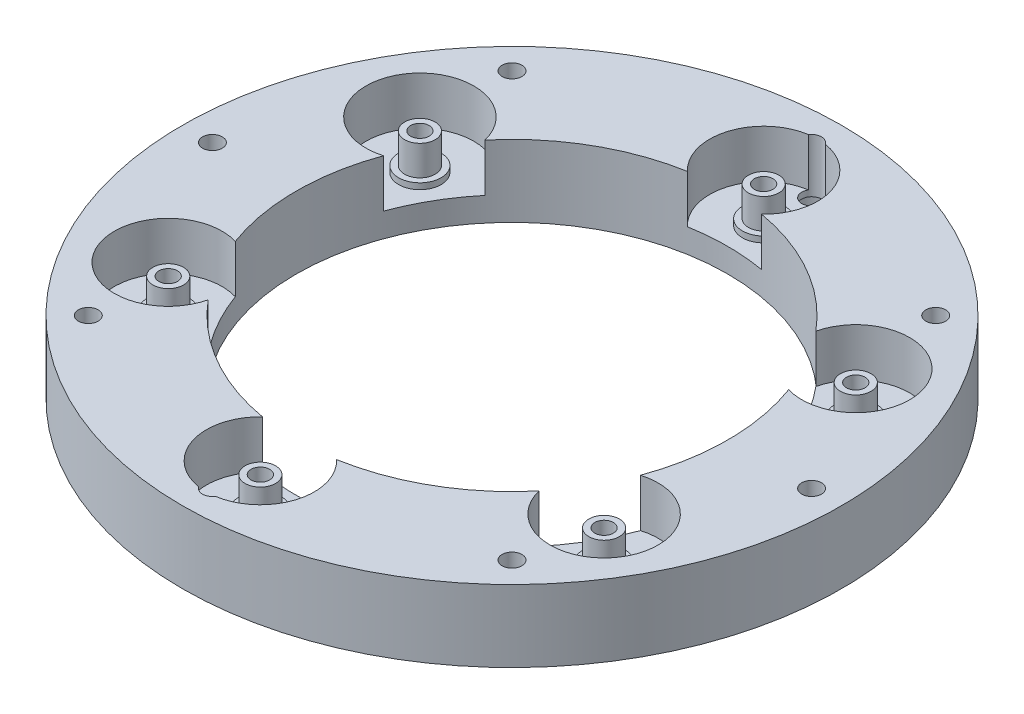
from build123d import *

# Parameters (mm, degrees)
SKETCH1_R           = 55
SKETCH1_R_2         = 36
SKETCH1_R_3         = 1.55
BOSS_EXTRUDE1_DEPTH = 4
SKETCH3_R           = 3.55
SKETCH3_R_2         = 1.55
BOSS_EXTRUDE2_DEPTH = 1
SKETCH5_R           = 2.55
SKETCH5_R_2         = 1.55
BOSS_EXTRUDE3_DEPTH = 5
SKETCH6_R           = 55
BOSS_EXTRUDE4_DEPTH = 8
SKETCH8_R           = 1.65
CUT_EXTRUDE2_DEPTH  = 79.70196948
SKETCH7_R           = 3.55
SKETCH7_R_2         = 1.55
SKETCH7_R_3         = 3.65
SKETCH7_R_4         = 1.65
CUT_EXTRUDE1_DEPTH  = 3


with BuildPart() as part:
    # Sketch1 → Boss-Extrude1 (new body)
    with BuildSketch(Plane(origin=(0, 0, 0), x_dir=(1, 0, 0), z_dir=(0, 1, 0))):
        Circle(SKETCH1_R)
        Circle(SKETCH1_R_2, mode=Mode.SUBTRACT)
        with Locations((0, 42)):
            Circle(SKETCH1_R_3, mode=Mode.SUBTRACT)
        with Locations((36.373066959, 21)):
            Circle(SKETCH1_R_3, mode=Mode.SUBTRACT)
        with Locations((36.373066959, -21)):
            Circle(SKETCH1_R_3, mode=Mode.SUBTRACT)
        with Locations((0, -42)):
            Circle(SKETCH1_R_3, mode=Mode.SUBTRACT)
        with Locations((-36.373066959, -21)):
            Circle(SKETCH1_R_3, mode=Mode.SUBTRACT)
        with Locations((-36.373066959, 21)):
            Circle(SKETCH1_R_3, mode=Mode.SUBTRACT)
    extrude(amount=BOSS_EXTRUDE1_DEPTH)

    # Sketch3 → Boss-Extrude2 (add)
    # profile 1 of 6: a face of its own
    with BuildSketch(Plane(origin=(0, 4, 0), x_dir=(1, 0, 0), z_dir=(0, 1, 0))):
        with Locations((-36.373066959, 21)):
            Circle(SKETCH3_R)
        with Locations((-36.373066959, 21)):
            Circle(SKETCH3_R_2, mode=Mode.SUBTRACT)
    # profile 2 of 6: a face of its own
    with BuildSketch(Plane(origin=(0, 4, 0), x_dir=(1, 0, 0), z_dir=(0, 1, 0))):
        with Locations((0, -42)):
            Circle(SKETCH3_R)
        with Locations((0, -42)):
            Circle(SKETCH3_R_2, mode=Mode.SUBTRACT)
    # profile 3 of 6: a face of its own
    with BuildSketch(Plane(origin=(0, 4, 0), x_dir=(1, 0, 0), z_dir=(0, 1, 0))):
        with Locations((36.373066959, 21)):
            Circle(SKETCH3_R)
        with Locations((36.373066959, 21)):
            Circle(SKETCH3_R_2, mode=Mode.SUBTRACT)
    # profile 4 of 6: a face of its own
    with BuildSketch(Plane(origin=(0, 4, 0), x_dir=(1, 0, 0), z_dir=(0, 1, 0))):
        with Locations((0, 42)):
            Circle(SKETCH3_R)
        with Locations((0, 42)):
            Circle(SKETCH3_R_2, mode=Mode.SUBTRACT)
    # profile 5 of 6: a face of its own
    with BuildSketch(Plane(origin=(0, 4, 0), x_dir=(1, 0, 0), z_dir=(0, 1, 0))):
        with Locations((36.373066959, -21)):
            Circle(SKETCH3_R)
        with Locations((36.373066959, -21)):
            Circle(SKETCH3_R_2, mode=Mode.SUBTRACT)
    # profile 6 of 6: a face of its own
    with BuildSketch(Plane(origin=(0, 4, 0), x_dir=(1, 0, 0), z_dir=(0, 1, 0))):
        with Locations((-36.373066959, -21)):
            Circle(SKETCH3_R)
        with Locations((-36.373066959, -21)):
            Circle(SKETCH3_R_2, mode=Mode.SUBTRACT)
    extrude(amount=BOSS_EXTRUDE2_DEPTH)

    # Sketch5 → Boss-Extrude3 (add)
    # profile 1 of 6: a face of its own
    with BuildSketch(Plane(origin=(0, 5, 0), x_dir=(1, 0, 0), z_dir=(0, 1, 0))):
        with Locations((-36.373066959, -21)):
            Circle(SKETCH5_R)
        with Locations((-36.373066959, -21)):
            Circle(SKETCH5_R_2, mode=Mode.SUBTRACT)
    # profile 2 of 6: a face of its own
    with BuildSketch(Plane(origin=(0, 5, 0), x_dir=(1, 0, 0), z_dir=(0, 1, 0))):
        with Locations((0, -42)):
            Circle(SKETCH5_R)
        with Locations((0, -42)):
            Circle(SKETCH5_R_2, mode=Mode.SUBTRACT)
    # profile 3 of 6: a face of its own
    with BuildSketch(Plane(origin=(0, 5, 0), x_dir=(1, 0, 0), z_dir=(0, 1, 0))):
        with Locations((36.373066959, -21)):
            Circle(SKETCH5_R)
        with Locations((36.373066959, -21)):
            Circle(SKETCH5_R_2, mode=Mode.SUBTRACT)
    # profile 4 of 6: a face of its own
    with BuildSketch(Plane(origin=(0, 5, 0), x_dir=(1, 0, 0), z_dir=(0, 1, 0))):
        with Locations((36.373066959, 21)):
            Circle(SKETCH5_R)
        with Locations((36.373066959, 21)):
            Circle(SKETCH5_R_2, mode=Mode.SUBTRACT)
    # profile 5 of 6: a face of its own
    with BuildSketch(Plane(origin=(0, 5, 0), x_dir=(1, 0, 0), z_dir=(0, 1, 0))):
        with Locations((0, 42)):
            Circle(SKETCH5_R)
        with Locations((0, 42)):
            Circle(SKETCH5_R_2, mode=Mode.SUBTRACT)
    # profile 6 of 6: a face of its own
    with BuildSketch(Plane(origin=(0, 5, 0), x_dir=(1, 0, 0), z_dir=(0, 1, 0))):
        with Locations((-36.373066959, 21)):
            Circle(SKETCH5_R)
        with Locations((-36.373066959, 21)):
            Circle(SKETCH5_R_2, mode=Mode.SUBTRACT)
    extrude(amount=BOSS_EXTRUDE3_DEPTH)

    # Sketch6 → Boss-Extrude4 (add)
    with BuildSketch(Plane(origin=(0, 4, 0), x_dir=(1, 0, 0), z_dir=(0, 1, 0))):
        Circle(SKETCH6_R)
        with BuildLine():
            ThreePointArc((6.187442022, 35.464285714), (0, 51), (-6.187442022, 35.464285714))
            ThreePointArc((-6.187442022, 35.464285714), (-18, 31.176914536), (-27.619251345, 23.090624833))
            ThreePointArc((-27.619251345, 23.090624833), (-44.167295593, 25.5), (-33.806693367, 12.373660882))
            ThreePointArc((-33.806693367, 12.373660882), (-36, 0), (-33.806693367, -12.373660882))
            ThreePointArc((-33.806693367, -12.373660882), (-44.167295593, -25.5), (-27.619251345, -23.090624833))
            ThreePointArc((-27.619251345, -23.090624833), (-18, -31.176914536), (-6.187442022, -35.464285714))
            ThreePointArc((-6.187442022, -35.464285714), (0, -51), (6.187442022, -35.464285714))
            ThreePointArc((6.187442022, -35.464285714), (18, -31.176914536), (27.619251345, -23.090624833))
            ThreePointArc((27.619251345, -23.090624833), (44.167295593, -25.5), (33.806693367, -12.373660882))
            ThreePointArc((33.806693367, -12.373660882), (36, 0), (33.806693367, 12.373660882))
            ThreePointArc((33.806693367, 12.373660882), (44.167295593, 25.5), (27.619251345, 23.090624833))
            ThreePointArc((27.619251345, 23.090624833), (18, 31.176914536), (6.187442022, 35.464285714))
        make_face(mode=Mode.SUBTRACT)
    extrude(amount=BOSS_EXTRUDE4_DEPTH)

    # Sketch8 → Cut-Extrude2 (cut, through all)
    with BuildSketch(Plane(origin=(0, 12, 0), x_dir=(1, 0, 0), z_dir=(0, 1, 0))):
        with Locations((0, 50)):
            Circle(SKETCH8_R)
        with Locations((35.355339059, 35.355339059)):
            Circle(SKETCH8_R)
        with Locations((50, 0)):
            Circle(SKETCH8_R)
        with Locations((35.355339059, -35.355339059)):
            Circle(SKETCH8_R)
        with Locations((0, -50)):
            Circle(SKETCH8_R)
        with Locations((-35.355339059, -35.355339059)):
            Circle(SKETCH8_R)
        with Locations((-50, 0)):
            Circle(SKETCH8_R)
        with Locations((-35.355339059, 35.355339059)):
            Circle(SKETCH8_R)
    extrude(amount=-CUT_EXTRUDE2_DEPTH, mode=Mode.SUBTRACT)

    # Sketch7 → Cut-Extrude1 (cut)
    # profile 1 of 14: a face of its own
    with BuildSketch(Plane.XZ):
        with Locations((-36.373066959, -21)):
            Circle(SKETCH7_R)
        with Locations((-36.373066959, -21)):
            Circle(SKETCH7_R_2, mode=Mode.SUBTRACT)
    # profile 2 of 14: a face of its own
    with BuildSketch(Plane.XZ):
        with Locations((-36.373066959, 21)):
            Circle(SKETCH7_R)
        with Locations((-36.373066959, 21)):
            Circle(SKETCH7_R_2, mode=Mode.SUBTRACT)
    # profile 3 of 14: a face of its own
    with BuildSketch(Plane.XZ):
        with Locations((0, 42)):
            Circle(SKETCH7_R)
        with Locations((0, 42)):
            Circle(SKETCH7_R_2, mode=Mode.SUBTRACT)
    # profile 4 of 14: a face of its own
    with BuildSketch(Plane.XZ):
        with Locations((36.373066959, 21)):
            Circle(SKETCH7_R)
        with Locations((36.373066959, 21)):
            Circle(SKETCH7_R_2, mode=Mode.SUBTRACT)
    # profile 5 of 14: a face of its own
    with BuildSketch(Plane.XZ):
        with Locations((36.373066959, -21)):
            Circle(SKETCH7_R)
        with Locations((36.373066959, -21)):
            Circle(SKETCH7_R_2, mode=Mode.SUBTRACT)
    # profile 6 of 14: a face of its own
    with BuildSketch(Plane.XZ):
        with Locations((0, -42)):
            Circle(SKETCH7_R)
        with Locations((0, -42)):
            Circle(SKETCH7_R_2, mode=Mode.SUBTRACT)
    # profile 7 of 14: a face of its own
    with BuildSketch(Plane.XZ):
        with Locations((-35.355339059, -35.355339059)):
            Circle(SKETCH7_R_3)
        with Locations((-35.355339059, -35.355339059)):
            Circle(SKETCH7_R_4, mode=Mode.SUBTRACT)
    # profile 8 of 14: a face of its own
    with BuildSketch(Plane.XZ):
        with Locations((-50, 0)):
            Circle(SKETCH7_R_3)
        with Locations((-50, 0)):
            Circle(SKETCH7_R_4, mode=Mode.SUBTRACT)
    # profile 9 of 14: a face of its own
    with BuildSketch(Plane.XZ):
        with Locations((-35.355339059, 35.355339059)):
            Circle(SKETCH7_R_3)
        with Locations((-35.355339059, 35.355339059)):
            Circle(SKETCH7_R_4, mode=Mode.SUBTRACT)
    # profile 10 of 14: a face of its own
    with BuildSketch(Plane.XZ):
        with Locations((0, 50)):
            Circle(SKETCH7_R_3)
        with Locations((0, 50)):
            Circle(SKETCH7_R_4, mode=Mode.SUBTRACT)
    # profile 11 of 14: a face of its own
    with BuildSketch(Plane.XZ):
        with Locations((35.355339059, 35.355339059)):
            Circle(SKETCH7_R_3)
        with Locations((35.355339059, 35.355339059)):
            Circle(SKETCH7_R_4, mode=Mode.SUBTRACT)
    # profile 12 of 14: a face of its own
    with BuildSketch(Plane.XZ):
        with Locations((50, 0)):
            Circle(SKETCH7_R_3)
        with Locations((50, 0)):
            Circle(SKETCH7_R_4, mode=Mode.SUBTRACT)
    # profile 13 of 14: a face of its own
    with BuildSketch(Plane.XZ):
        with Locations((35.355339059, -35.355339059)):
            Circle(SKETCH7_R_3)
        with Locations((35.355339059, -35.355339059)):
            Circle(SKETCH7_R_4, mode=Mode.SUBTRACT)
    # profile 14 of 14: a face of its own
    with BuildSketch(Plane.XZ):
        with Locations((0, -50)):
            Circle(SKETCH7_R_3)
        with Locations((0, -50)):
            Circle(SKETCH7_R_4, mode=Mode.SUBTRACT)
    extrude(amount=-CUT_EXTRUDE1_DEPTH, mode=Mode.SUBTRACT)


solid = part.part
